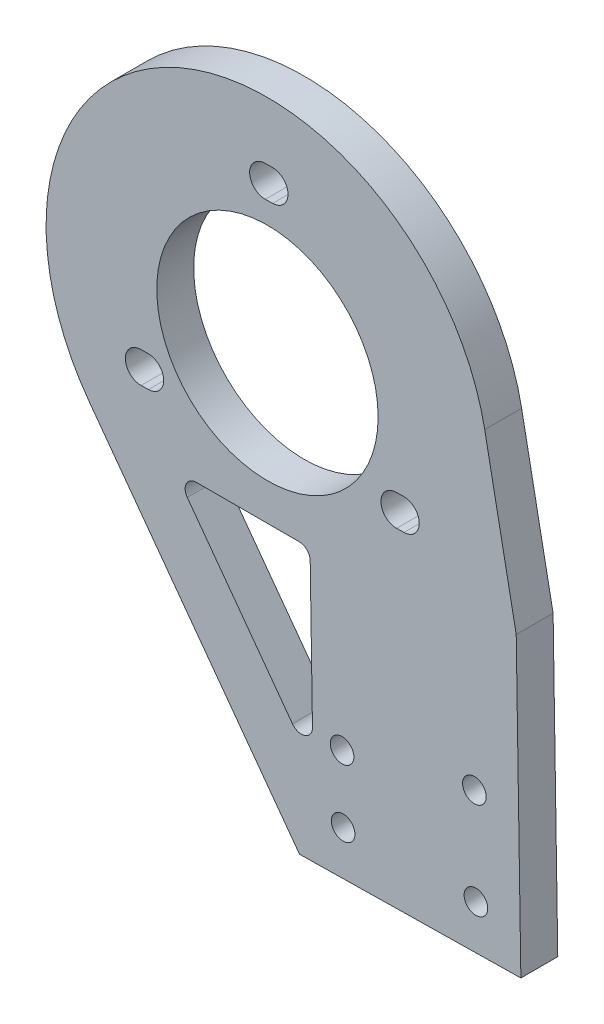
from build123d import *

# Parameters (mm, degrees)
EXTRUDE_1_DEPTH     = 5
SKETCH_3_R          = 15
SKETCH_3_R_2        = 2.1
CUT_EXTRUDE_1_DEPTH = 5
CUT_EXTRUDE_4_DEPTH = 10
SKETCH1_R           = 1.6
CUT_EXTRUDE1_DEPTH  = 18
CUT_EXTRUDE2_DEPTH  = 18


with BuildPart() as part:
    # 草图2 → 凸台-拉伸1 (new body)
    with BuildSketch(Plane.XY):
        with BuildLine():
            Line((134.322983451, -112.370861552), (130.055453769, -90.453225425))
            ThreePointArc((130.055453769, -90.453225425), (88.580905977, -68.70336217), (76.416062492, -113.927374035))
            Line((76.416062492, -113.927374035), (104.954507892, -152.844504883))
            Line((104.954507892, -152.844504883), (134.954507892, -152.370861552))
            Line((134.954507892, -152.370861552), (134.322983451, -112.370861552))
        make_face()
    extrude(amount=EXTRUDE_1_DEPTH)

    # 草图3 → 切除-拉伸1 (cut)
    with BuildSketch(Plane.XY.offset(5)):
        with Locations((100.608444747, -96.186781011)):
            Circle(SKETCH_3_R)
        with Locations((118.084143327, -105.911825611)):
            Circle(SKETCH_3_R_2)
        with Locations((83.44845978, -106.458657629)):
            Circle(SKETCH_3_R_2)
        with Locations((100.292731134, -76.189859791)):
            Circle(SKETCH_3_R_2)
    extrude(amount=-CUT_EXTRUDE_1_DEPTH, mode=Mode.SUBTRACT)

    # 草图7 → 切除-拉伸4 (cut)
    with BuildSketch(Plane.XY.offset(5)):
        with BuildLine():
            Line((101.325757427, -78.273811969), (100.325882036, -78.289598113))
            ThreePointArc((100.325882036, -78.289598113), (98.192992813, -76.223010693), (100.259580233, -74.09012147))
            Line((100.259580233, -74.09012147), (101.259455624, -74.074335326))
            ThreePointArc((101.259455624, -74.074335326), (103.392344847, -76.140922746), (101.325757427, -78.273811969))
        make_face()
        with BuildLine():
            Line((119.117169619, -107.995777789), (118.117294228, -108.011563933))
            ThreePointArc((118.117294228, -108.011563933), (115.984405005, -105.944976513), (118.050992425, -103.81208729))
            Line((118.050992425, -103.81208729), (119.050867816, -103.796301146))
            ThreePointArc((119.050867816, -103.796301146), (121.183757039, -105.862888566), (119.117169619, -107.995777789))
        make_face()
        with BuildLine():
            Line((84.481486073, -108.542609806), (83.481610682, -108.55839595))
            ThreePointArc((83.481610682, -108.55839595), (81.348721459, -106.491808531), (83.415308878, -104.358919308))
            Line((83.415308878, -104.358919308), (84.415184269, -104.343133164))
            ThreePointArc((84.415184269, -104.343133164), (86.548073492, -106.409720583), (84.481486073, -108.542609806))
        make_face()
    extrude(amount=-CUT_EXTRUDE_4_DEPTH, mode=Mode.SUBTRACT)

    # Sketch1 → Cut-Extrude1 (cut)
    with BuildSketch(Plane.XY.offset(5)):
        with Locations((110.720688645, -137.750476655)):
            Circle(SKETCH1_R)
        with Locations((110.862781644, -146.750476655)):
            Circle(SKETCH1_R)
        with Locations((128.860538683, -146.466326068)):
            Circle(SKETCH1_R)
        with Locations((128.65529324, -133.466326068)):
            Circle(SKETCH1_R)
    extrude(amount=-CUT_EXTRUDE1_DEPTH, mode=Mode.SUBTRACT)

    # Sketch2 → Cut-Extrude2 (cut)
    with BuildSketch(Plane.XY.offset(5)):
        with BuildLine():
            Line((89.74383393, -118.573810662), (104.00056121, -138.01533641))
            ThreePointArc((104.00056121, -138.01533641), (105.688093281, -138.550136286), (106.70999341, -137.104627543))
            Line((106.70999341, -137.104627543), (106.403048442, -117.663101795))
            ThreePointArc((106.403048442, -117.663101795), (105.955490357, -116.617781753), (104.903235356, -116.186781011))
            Line((104.903235356, -116.186781011), (90.953453042, -116.186781011))
            ThreePointArc((90.953453042, -116.186781011), (89.61544249, -117.008748739), (89.74383393, -118.573810662))
        make_face()
    extrude(amount=-CUT_EXTRUDE2_DEPTH, mode=Mode.SUBTRACT)


solid = part.part
